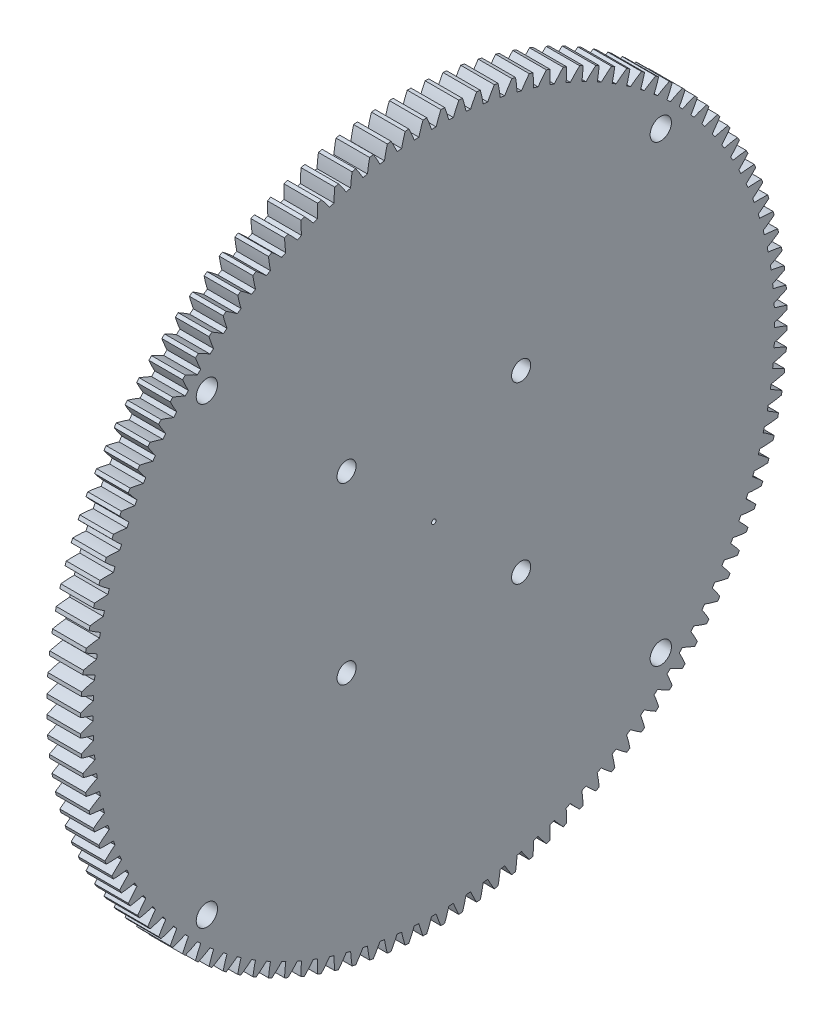
from build123d import *

# Parameters (mm, degrees)
BASPROSKE_W        = 6
BASPROSKE_H        = 63
TOOTHCUT_DEPTH     = 90.297256397
TEETHCUTS_COUNT    = 124
TEETHCUTS_ANGLE    = 357.096774194
BORSKE_R           = 0.4
BORE_DEPTH         = 50.0000508
CUT_EXTRUDE2_REACH = 91.28
SKETCH3_R          = 1.9
CIRPATTERN1_COUNT  = 4
CUT_EXTRUDE3_REACH = 91.28
SKETCH5_R          = 1.7
CIRPATTERN2_COUNT  = 4


with BuildPart() as part:
    # BasProSke → Base-Revolve (revolve)
    with BuildSketch(Plane(origin=(0, 0, 0), x_dir=(1, 0, 0), z_dir=(0, 1, 0))):
        with Locations((3, 31.5)):
            Rectangle(BASPROSKE_W, BASPROSKE_H)
    revolve(axis=Axis((-10, 0, 0), (1, 0, 0)))

    # TooCutSke → ToothCut (cut, through all)
    with BuildSketch(Plane(origin=(0, 0, 0), x_dir=(0, 0, -1), z_dir=(1, 0, 0))):
        with BuildLine():
            ThreePointArc((0.410069445, 60.747615954), (0, 60.749), (-0.410069445, 60.747615954))
            ThreePointArc((-0.410069445, 60.747615954), (-0.812309184, 61.890616344), (-1.269898411, 63.012605113))
            ThreePointArc((-1.269898411, 63.012605113), (0, 63.0254), (1.269898411, 63.012605113))
            ThreePointArc((1.269898411, 63.012605113), (0.812309184, 61.890616344), (0.410069445, 60.747615954))
        make_face()
    toothcut = extrude(amount=TOOTHCUT_DEPTH, mode=Mode.SUBTRACT)

    # TeethCuts: ToothCut ×124 about axis
    teethcuts_axis = Axis((-10, 0, 0), (1, 0, 0))
    for i in range(1, TEETHCUTS_COUNT):
        add(toothcut.rotate(teethcuts_axis, i * TEETHCUTS_ANGLE / (TEETHCUTS_COUNT - 1)), mode=Mode.SUBTRACT)

    # BorSke → Bore (cut, symmetric)
    with BuildSketch(Plane(origin=(0, 0, 0), x_dir=(0, 0, -1), z_dir=(1, 0, 0))):
        Circle(BORSKE_R)
    extrude(amount=BORE_DEPTH, both=True, mode=Mode.SUBTRACT)

    # Sketch3 → Cut-Extrude2 (cut, up to next)
    with BuildSketch(Plane.ZY, mode=Mode.PRIVATE) as cut_extrude2_sk1:
        with Locations((-40.449972707, 40.449972707)):
            Circle(SKETCH3_R)
    cut_extrude2_tool1 = extrude(cut_extrude2_sk1.sketch, amount=-CUT_EXTRUDE2_REACH, mode=Mode.PRIVATE) & part.part
    cut_extrude2 = cut_extrude2_tool1.solids().sort_by_distance((0, 40.449973, -40.449973))[0]
    add(cut_extrude2, mode=Mode.SUBTRACT)

    # CirPattern1: Cut-Extrude2 ×4 about axis
    cirpattern1_axis = Axis((50.0000508, 0, 0), (-1, 0, 0))
    for i in range(1, CIRPATTERN1_COUNT):
        add(cut_extrude2.rotate(cirpattern1_axis, i * 360 / CIRPATTERN1_COUNT), mode=Mode.SUBTRACT)

    # Sketch5 → Cut-Extrude3 (cut, up to next)
    with BuildSketch(Plane.ZY, mode=Mode.PRIVATE) as cut_extrude3_sk1:
        with Locations((-15.556349186, 15.556349186)):
            Circle(SKETCH5_R)
    cut_extrude3_tool1 = extrude(cut_extrude3_sk1.sketch, amount=-CUT_EXTRUDE3_REACH, mode=Mode.PRIVATE) & part.part
    cut_extrude3 = cut_extrude3_tool1.solids().sort_by_distance((0, 15.556349, -15.556349))[0]
    add(cut_extrude3, mode=Mode.SUBTRACT)

    # CirPattern2: Cut-Extrude3 ×4 about axis
    cirpattern2_axis = Axis((50.0000508, 0, 0), (-1, 0, 0))
    for i in range(1, CIRPATTERN2_COUNT):
        add(cut_extrude3.rotate(cirpattern2_axis, i * 360 / CIRPATTERN2_COUNT), mode=Mode.SUBTRACT)


solid = part.part
